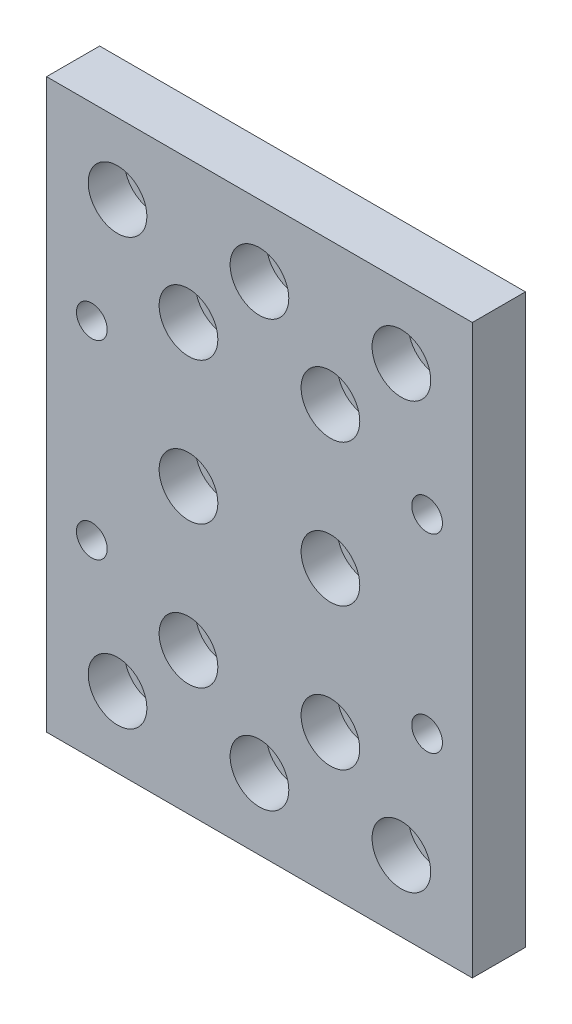
from build123d import *

# Parameters (mm, degrees)
SKETCH1_W           = 76.2
SKETCH1_H           = 101.6
SKETCH1_R           = 3.175
SKETCH1_R_2         = 3.429
SKETCH1_R_3         = 2.75
BOSS_EXTRUDE1_DEPTH = 9.5
SKETCH_1_R          = 5.25
CUT_EXTRUDE_1_DEPTH = 6.5


with BuildPart() as part:
    # Sketch1 → Boss-Extrude1 (new body)
    with BuildSketch(Plane.XY):
        with Locations((-26.419970967, 29.8958)):
            Rectangle(SKETCH1_W, SKETCH1_H)
        with Locations((-13.719970967, 29.8958)):
            Circle(SKETCH1_R, mode=Mode.SUBTRACT)
        with Locations((-13.719970967, 55.2958)):
            Circle(SKETCH1_R, mode=Mode.SUBTRACT)
        with Locations((-1.019970967, 67.9958)):
            Circle(SKETCH1_R, mode=Mode.SUBTRACT)
        with Locations((-39.119970967, 4.4958)):
            Circle(SKETCH1_R_2, mode=Mode.SUBTRACT)
        with Locations((-13.719970967, 4.4958)):
            Circle(SKETCH1_R_2, mode=Mode.SUBTRACT)
        with Locations((-26.419970967, 67.9958)):
            Circle(SKETCH1_R, mode=Mode.SUBTRACT)
        with Locations((-39.119970967, 55.2958)):
            Circle(SKETCH1_R, mode=Mode.SUBTRACT)
        with Locations((-51.819970967, 67.9958)):
            Circle(SKETCH1_R, mode=Mode.SUBTRACT)
        with Locations((-39.119970967, 29.8958)):
            Circle(SKETCH1_R, mode=Mode.SUBTRACT)
        with Locations((-1.019970967, -8.2042)):
            Circle(SKETCH1_R, mode=Mode.SUBTRACT)
        with Locations((-26.419970967, -8.2042)):
            Circle(SKETCH1_R, mode=Mode.SUBTRACT)
        with Locations((-51.819970967, -8.2042)):
            Circle(SKETCH1_R, mode=Mode.SUBTRACT)
        with Locations((-56.419970967, 46.8958)):
            Circle(SKETCH1_R_3, mode=Mode.SUBTRACT)
        with Locations((3.580029033, 46.8958)):
            Circle(SKETCH1_R_3, mode=Mode.SUBTRACT)
        with Locations((-56.419970967, 12.8958)):
            Circle(SKETCH1_R_3, mode=Mode.SUBTRACT)
        with Locations((3.580029033, 12.8958)):
            Circle(SKETCH1_R_3, mode=Mode.SUBTRACT)
    extrude(amount=BOSS_EXTRUDE1_DEPTH)

    # 草图1 → 切除-拉伸1 (cut)
    with BuildSketch(Plane.XY.offset(9.5)):
        with Locations((-51.819970967, -8.2042)):
            Circle(SKETCH_1_R)
        with Locations((-26.419970967, -8.2042)):
            Circle(SKETCH_1_R)
        with Locations((-1.019970967, -8.2042)):
            Circle(SKETCH_1_R)
        with Locations((-39.119970967, 29.8958)):
            Circle(SKETCH_1_R)
        with Locations((-13.719970967, 29.8958)):
            Circle(SKETCH_1_R)
        with Locations((-39.119970967, 55.2958)):
            Circle(SKETCH_1_R)
        with Locations((-13.719970967, 55.2958)):
            Circle(SKETCH_1_R)
        with Locations((-1.019970967, 67.9958)):
            Circle(SKETCH_1_R)
        with Locations((-26.419970967, 67.9958)):
            Circle(SKETCH_1_R)
        with Locations((-51.819970967, 67.9958)):
            Circle(SKETCH_1_R)
        with Locations((-13.719970967, 4.4958)):
            Circle(SKETCH_1_R)
        with Locations((-39.119970967, 4.4958)):
            Circle(SKETCH_1_R)
    extrude(amount=-CUT_EXTRUDE_1_DEPTH, mode=Mode.SUBTRACT)


solid = part.part
